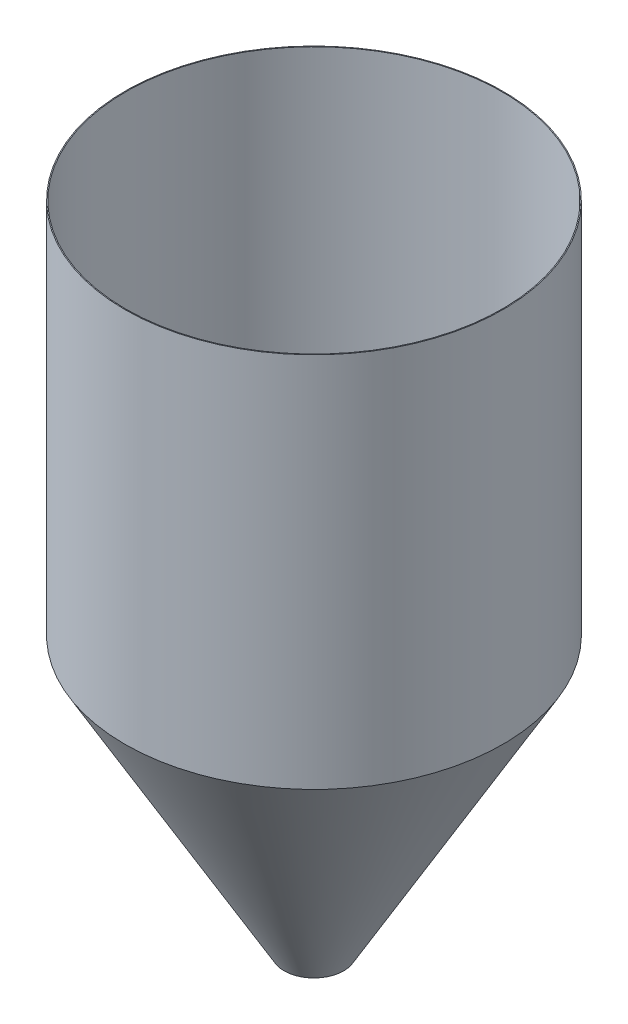
from build123d import *

# Parameters (mm, degrees)
SKETCH1_R           = 255.21412
SKETCH1_R_2         = 254
BOSS_EXTRUDE1_DEPTH = 508


with BuildPart() as part:
    # Sketch1 → Boss-Extrude1 (new body)
    with BuildSketch(Plane(origin=(0, 0, 0), x_dir=(1, 0, 0), z_dir=(0, 1, 0))):
        Circle(SKETCH1_R)
        Circle(SKETCH1_R_2, mode=Mode.SUBTRACT)
    extrude(amount=BOSS_EXTRUDE1_DEPTH)

    # Sketch2 → Revolve1 (revolve)
    with BuildSketch(Plane.XY):
        Polygon((254, 0), (38.989, -372.409976186), (40.20312, -372.409976186), (255.21412, 0), align=None)
    revolve(axis=Axis((0, -439.940905122, 0), (0, 1, 0)))


solid = part.part
